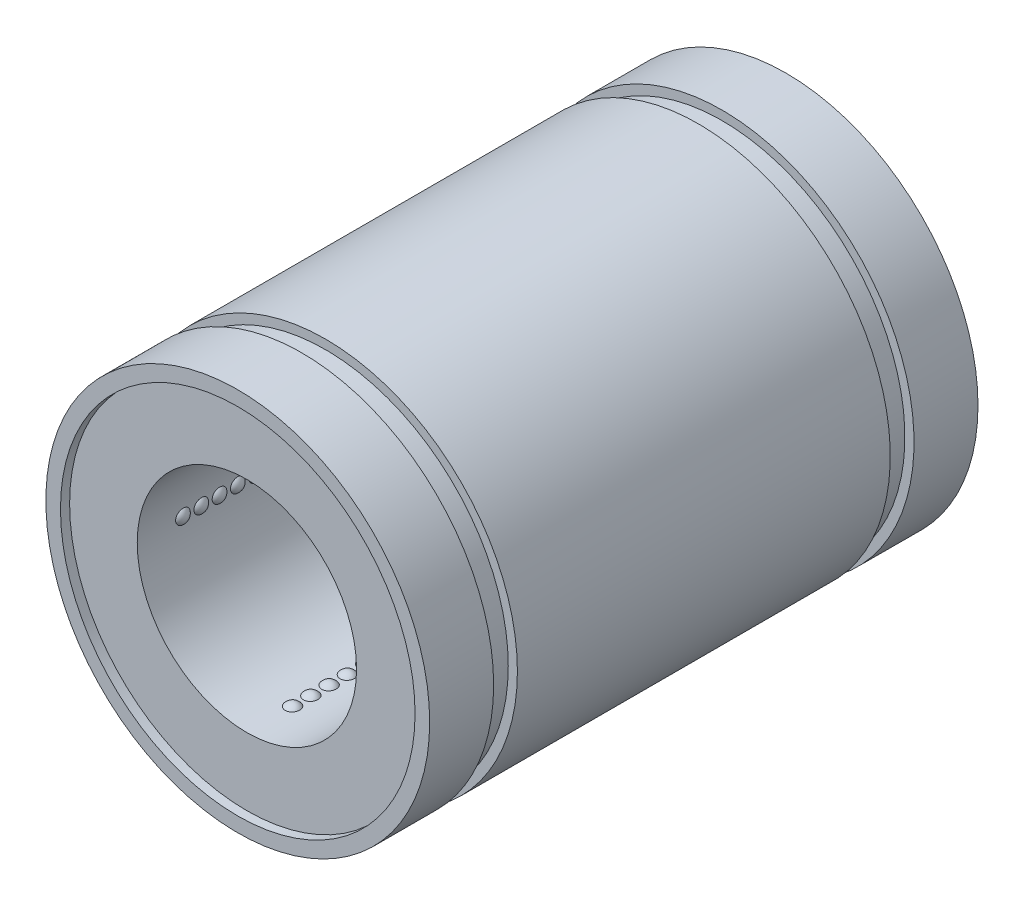
from build123d import *

# Parameters (mm, degrees)
SKETCH1_R           = 10.5
SKETCH1_R_2         = 6
BOSS_EXTRUDE1_DEPTH = 30
CUT_EXTRUDE1_START  = -0.5
SKETCH2_R           = 9.7
SKETCH2_R_2         = 6
CUT_EXTRUDE1_DEPTH  = 0.5
SKETCH3_R           = 9.7
SKETCH3_R_2         = 6
CUT_EXTRUDE2_DEPTH  = 0.5
LPATTERN1_COUNT     = 25
LPATTERN1_PITCH     = 1
CIRPATTERN1_COUNT   = 4
SKETCH5_R           = 11.625558181
SKETCH5_R_2         = 10
CUT_EXTRUDE3_DEPTH  = 1.3
CUT_EXTRUDE4_START  = -1.3
SKETCH6_R           = 11.731970737
SKETCH6_R_2         = 10
CUT_EXTRUDE4_DEPTH  = 1.3


with BuildPart() as part:
    # Sketch1 → Boss-Extrude1 (new body)
    with BuildSketch(Plane.XY):
        Circle(SKETCH1_R)
        Circle(SKETCH1_R_2, mode=Mode.SUBTRACT)
    extrude(amount=BOSS_EXTRUDE1_DEPTH)

    # Sketch2 → Cut-Extrude1 (cut)
    with BuildSketch(Plane.XY.offset(30).offset(CUT_EXTRUDE1_START)):
        Circle(SKETCH2_R)
        Circle(SKETCH2_R_2, mode=Mode.SUBTRACT)
    extrude(amount=CUT_EXTRUDE1_DEPTH, mode=Mode.SUBTRACT)

    # Sketch3 → Cut-Extrude2 (cut)
    with BuildSketch(Plane(origin=(0, 0, 0), x_dir=(-1, 0, 0), z_dir=(0, 0, -1))):
        with Locations(Location((0, 0, 0), (0, 0, 180))):
            Circle(SKETCH3_R)
        Circle(SKETCH3_R_2, mode=Mode.SUBTRACT)
    extrude(amount=-CUT_EXTRUDE2_DEPTH, mode=Mode.SUBTRACT)

    # Sketch4 → Revolve1 (revolve)
    with BuildSketch(Plane.XY.offset(27)):
        with BuildLine():
            Line((0, -5.8), (0, -6.8))
            ThreePointArc((0, -6.8), (0.5, -6.3), (0, -5.8))
        make_face()
    revolve1 = revolve(axis=Axis((0, -5.8, 27), (0, -1, 0)))

    # LPattern1: Revolve1 ×25
    with Locations(*[(0, 0, -i * LPATTERN1_PITCH) for i in range(1, LPATTERN1_COUNT)]):
        add(revolve1)

    # CirPattern1: Revolve1 ×4 about axis
    cirpattern1_axis = Axis((0, 0, 0), (0, 0, 1))
    for i in range(1, CIRPATTERN1_COUNT):
        add(revolve1.rotate(cirpattern1_axis, i * 360 / CIRPATTERN1_COUNT))

    # CirPattern1 copy 1 sketch → CirPattern1 copy 1 (revolve)
    with BuildSketch(Plane(origin=(0, 0, 26), x_dir=(0, 1, 0), z_dir=(0, 0, 1))):
        with BuildLine():
            Line((0, -5.8), (0, -6.8))
            ThreePointArc((0, -6.8), (0.5, -6.3), (0, -5.8))
        make_face()
    revolve(axis=Axis((5.8, 0, 26), (1, 0, 0)))

    # CirPattern1 copy 2 sketch → CirPattern1 copy 2 (revolve)
    with BuildSketch(Plane(origin=(0, 0, 26), x_dir=(-1, 0, 0), z_dir=(0, 0, 1))):
        with BuildLine():
            Line((0, -5.8), (0, -6.8))
            ThreePointArc((0, -6.8), (0.5, -6.3), (0, -5.8))
        make_face()
    revolve(axis=Axis((0, 5.8, 26), (0, 1, 0)))

    # CirPattern1 copy 3 sketch → CirPattern1 copy 3 (revolve)
    with BuildSketch(Plane(origin=(0, 0, 26), x_dir=(0, -1, 0), z_dir=(0, 0, 1))):
        with BuildLine():
            Line((0, -5.8), (0, -6.8))
            ThreePointArc((0, -6.8), (0.5, -6.3), (0, -5.8))
        make_face()
    revolve(axis=Axis((-5.8, 0, 26), (-1, 0, 0)))

    # CirPattern1 copy 4 sketch → CirPattern1 copy 4 (revolve)
    with BuildSketch(Plane(origin=(0, 0, 25), x_dir=(0, 1, 0), z_dir=(0, 0, 1))):
        with BuildLine():
            Line((0, -5.8), (0, -6.8))
            ThreePointArc((0, -6.8), (0.5, -6.3), (0, -5.8))
        make_face()
    revolve(axis=Axis((5.8, 0, 25), (1, 0, 0)))

    # CirPattern1 copy 5 sketch → CirPattern1 copy 5 (revolve)
    with BuildSketch(Plane(origin=(0, 0, 25), x_dir=(-1, 0, 0), z_dir=(0, 0, 1))):
        with BuildLine():
            Line((0, -5.8), (0, -6.8))
            ThreePointArc((0, -6.8), (0.5, -6.3), (0, -5.8))
        make_face()
    revolve(axis=Axis((0, 5.8, 25), (0, 1, 0)))

    # CirPattern1 copy 6 sketch → CirPattern1 copy 6 (revolve)
    with BuildSketch(Plane(origin=(0, 0, 25), x_dir=(0, -1, 0), z_dir=(0, 0, 1))):
        with BuildLine():
            Line((0, -5.8), (0, -6.8))
            ThreePointArc((0, -6.8), (0.5, -6.3), (0, -5.8))
        make_face()
    revolve(axis=Axis((-5.8, 0, 25), (-1, 0, 0)))

    # CirPattern1 copy 7 sketch → CirPattern1 copy 7 (revolve)
    with BuildSketch(Plane(origin=(0, 0, 24), x_dir=(0, 1, 0), z_dir=(0, 0, 1))):
        with BuildLine():
            Line((0, -5.8), (0, -6.8))
            ThreePointArc((0, -6.8), (0.5, -6.3), (0, -5.8))
        make_face()
    revolve(axis=Axis((5.8, 0, 24), (1, 0, 0)))

    # CirPattern1 copy 8 sketch → CirPattern1 copy 8 (revolve)
    with BuildSketch(Plane(origin=(0, 0, 24), x_dir=(-1, 0, 0), z_dir=(0, 0, 1))):
        with BuildLine():
            Line((0, -5.8), (0, -6.8))
            ThreePointArc((0, -6.8), (0.5, -6.3), (0, -5.8))
        make_face()
    revolve(axis=Axis((0, 5.8, 24), (0, 1, 0)))

    # CirPattern1 copy 9 sketch → CirPattern1 copy 9 (revolve)
    with BuildSketch(Plane(origin=(0, 0, 24), x_dir=(0, -1, 0), z_dir=(0, 0, 1))):
        with BuildLine():
            Line((0, -5.8), (0, -6.8))
            ThreePointArc((0, -6.8), (0.5, -6.3), (0, -5.8))
        make_face()
    revolve(axis=Axis((-5.8, 0, 24), (-1, 0, 0)))

    # CirPattern1 copy 10 sketch → CirPattern1 copy 10 (revolve)
    with BuildSketch(Plane(origin=(0, 0, 23), x_dir=(0, 1, 0), z_dir=(0, 0, 1))):
        with BuildLine():
            Line((0, -5.8), (0, -6.8))
            ThreePointArc((0, -6.8), (0.5, -6.3), (0, -5.8))
        make_face()
    revolve(axis=Axis((5.8, 0, 23), (1, 0, 0)))

    # CirPattern1 copy 11 sketch → CirPattern1 copy 11 (revolve)
    with BuildSketch(Plane(origin=(0, 0, 23), x_dir=(-1, 0, 0), z_dir=(0, 0, 1))):
        with BuildLine():
            Line((0, -5.8), (0, -6.8))
            ThreePointArc((0, -6.8), (0.5, -6.3), (0, -5.8))
        make_face()
    revolve(axis=Axis((0, 5.8, 23), (0, 1, 0)))

    # CirPattern1 copy 12 sketch → CirPattern1 copy 12 (revolve)
    with BuildSketch(Plane(origin=(0, 0, 23), x_dir=(0, -1, 0), z_dir=(0, 0, 1))):
        with BuildLine():
            Line((0, -5.8), (0, -6.8))
            ThreePointArc((0, -6.8), (0.5, -6.3), (0, -5.8))
        make_face()
    revolve(axis=Axis((-5.8, 0, 23), (-1, 0, 0)))

    # CirPattern1 copy 13 sketch → CirPattern1 copy 13 (revolve)
    with BuildSketch(Plane(origin=(0, 0, 22), x_dir=(0, 1, 0), z_dir=(0, 0, 1))):
        with BuildLine():
            Line((0, -5.8), (0, -6.8))
            ThreePointArc((0, -6.8), (0.5, -6.3), (0, -5.8))
        make_face()
    revolve(axis=Axis((5.8, 0, 22), (1, 0, 0)))

    # CirPattern1 copy 14 sketch → CirPattern1 copy 14 (revolve)
    with BuildSketch(Plane(origin=(0, 0, 22), x_dir=(-1, 0, 0), z_dir=(0, 0, 1))):
        with BuildLine():
            Line((0, -5.8), (0, -6.8))
            ThreePointArc((0, -6.8), (0.5, -6.3), (0, -5.8))
        make_face()
    revolve(axis=Axis((0, 5.8, 22), (0, 1, 0)))

    # CirPattern1 copy 15 sketch → CirPattern1 copy 15 (revolve)
    with BuildSketch(Plane(origin=(0, 0, 22), x_dir=(0, -1, 0), z_dir=(0, 0, 1))):
        with BuildLine():
            Line((0, -5.8), (0, -6.8))
            ThreePointArc((0, -6.8), (0.5, -6.3), (0, -5.8))
        make_face()
    revolve(axis=Axis((-5.8, 0, 22), (-1, 0, 0)))

    # CirPattern1 copy 16 sketch → CirPattern1 copy 16 (revolve)
    with BuildSketch(Plane(origin=(0, 0, 21), x_dir=(0, 1, 0), z_dir=(0, 0, 1))):
        with BuildLine():
            Line((0, -5.8), (0, -6.8))
            ThreePointArc((0, -6.8), (0.5, -6.3), (0, -5.8))
        make_face()
    revolve(axis=Axis((5.8, 0, 21), (1, 0, 0)))

    # CirPattern1 copy 17 sketch → CirPattern1 copy 17 (revolve)
    with BuildSketch(Plane(origin=(0, 0, 21), x_dir=(-1, 0, 0), z_dir=(0, 0, 1))):
        with BuildLine():
            Line((0, -5.8), (0, -6.8))
            ThreePointArc((0, -6.8), (0.5, -6.3), (0, -5.8))
        make_face()
    revolve(axis=Axis((0, 5.8, 21), (0, 1, 0)))

    # CirPattern1 copy 18 sketch → CirPattern1 copy 18 (revolve)
    with BuildSketch(Plane(origin=(0, 0, 21), x_dir=(0, -1, 0), z_dir=(0, 0, 1))):
        with BuildLine():
            Line((0, -5.8), (0, -6.8))
            ThreePointArc((0, -6.8), (0.5, -6.3), (0, -5.8))
        make_face()
    revolve(axis=Axis((-5.8, 0, 21), (-1, 0, 0)))

    # CirPattern1 copy 19 sketch → CirPattern1 copy 19 (revolve)
    with BuildSketch(Plane(origin=(0, 0, 20), x_dir=(0, 1, 0), z_dir=(0, 0, 1))):
        with BuildLine():
            Line((0, -5.8), (0, -6.8))
            ThreePointArc((0, -6.8), (0.5, -6.3), (0, -5.8))
        make_face()
    revolve(axis=Axis((5.8, 0, 20), (1, 0, 0)))

    # CirPattern1 copy 20 sketch → CirPattern1 copy 20 (revolve)
    with BuildSketch(Plane(origin=(0, 0, 20), x_dir=(-1, 0, 0), z_dir=(0, 0, 1))):
        with BuildLine():
            Line((0, -5.8), (0, -6.8))
            ThreePointArc((0, -6.8), (0.5, -6.3), (0, -5.8))
        make_face()
    revolve(axis=Axis((0, 5.8, 20), (0, 1, 0)))

    # CirPattern1 copy 21 sketch → CirPattern1 copy 21 (revolve)
    with BuildSketch(Plane(origin=(0, 0, 20), x_dir=(0, -1, 0), z_dir=(0, 0, 1))):
        with BuildLine():
            Line((0, -5.8), (0, -6.8))
            ThreePointArc((0, -6.8), (0.5, -6.3), (0, -5.8))
        make_face()
    revolve(axis=Axis((-5.8, 0, 20), (-1, 0, 0)))

    # CirPattern1 copy 22 sketch → CirPattern1 copy 22 (revolve)
    with BuildSketch(Plane(origin=(0, 0, 19), x_dir=(0, 1, 0), z_dir=(0, 0, 1))):
        with BuildLine():
            Line((0, -5.8), (0, -6.8))
            ThreePointArc((0, -6.8), (0.5, -6.3), (0, -5.8))
        make_face()
    revolve(axis=Axis((5.8, 0, 19), (1, 0, 0)))

    # CirPattern1 copy 23 sketch → CirPattern1 copy 23 (revolve)
    with BuildSketch(Plane(origin=(0, 0, 19), x_dir=(-1, 0, 0), z_dir=(0, 0, 1))):
        with BuildLine():
            Line((0, -5.8), (0, -6.8))
            ThreePointArc((0, -6.8), (0.5, -6.3), (0, -5.8))
        make_face()
    revolve(axis=Axis((0, 5.8, 19), (0, 1, 0)))

    # CirPattern1 copy 24 sketch → CirPattern1 copy 24 (revolve)
    with BuildSketch(Plane(origin=(0, 0, 19), x_dir=(0, -1, 0), z_dir=(0, 0, 1))):
        with BuildLine():
            Line((0, -5.8), (0, -6.8))
            ThreePointArc((0, -6.8), (0.5, -6.3), (0, -5.8))
        make_face()
    revolve(axis=Axis((-5.8, 0, 19), (-1, 0, 0)))

    # CirPattern1 copy 25 sketch → CirPattern1 copy 25 (revolve)
    with BuildSketch(Plane(origin=(0, 0, 18), x_dir=(0, 1, 0), z_dir=(0, 0, 1))):
        with BuildLine():
            Line((0, -5.8), (0, -6.8))
            ThreePointArc((0, -6.8), (0.5, -6.3), (0, -5.8))
        make_face()
    revolve(axis=Axis((5.8, 0, 18), (1, 0, 0)))

    # CirPattern1 copy 26 sketch → CirPattern1 copy 26 (revolve)
    with BuildSketch(Plane(origin=(0, 0, 18), x_dir=(-1, 0, 0), z_dir=(0, 0, 1))):
        with BuildLine():
            Line((0, -5.8), (0, -6.8))
            ThreePointArc((0, -6.8), (0.5, -6.3), (0, -5.8))
        make_face()
    revolve(axis=Axis((0, 5.8, 18), (0, 1, 0)))

    # CirPattern1 copy 27 sketch → CirPattern1 copy 27 (revolve)
    with BuildSketch(Plane(origin=(0, 0, 18), x_dir=(0, -1, 0), z_dir=(0, 0, 1))):
        with BuildLine():
            Line((0, -5.8), (0, -6.8))
            ThreePointArc((0, -6.8), (0.5, -6.3), (0, -5.8))
        make_face()
    revolve(axis=Axis((-5.8, 0, 18), (-1, 0, 0)))

    # CirPattern1 copy 28 sketch → CirPattern1 copy 28 (revolve)
    with BuildSketch(Plane(origin=(0, 0, 17), x_dir=(0, 1, 0), z_dir=(0, 0, 1))):
        with BuildLine():
            Line((0, -5.8), (0, -6.8))
            ThreePointArc((0, -6.8), (0.5, -6.3), (0, -5.8))
        make_face()
    revolve(axis=Axis((5.8, 0, 17), (1, 0, 0)))

    # CirPattern1 copy 29 sketch → CirPattern1 copy 29 (revolve)
    with BuildSketch(Plane(origin=(0, 0, 17), x_dir=(-1, 0, 0), z_dir=(0, 0, 1))):
        with BuildLine():
            Line((0, -5.8), (0, -6.8))
            ThreePointArc((0, -6.8), (0.5, -6.3), (0, -5.8))
        make_face()
    revolve(axis=Axis((0, 5.8, 17), (0, 1, 0)))

    # CirPattern1 copy 30 sketch → CirPattern1 copy 30 (revolve)
    with BuildSketch(Plane(origin=(0, 0, 17), x_dir=(0, -1, 0), z_dir=(0, 0, 1))):
        with BuildLine():
            Line((0, -5.8), (0, -6.8))
            ThreePointArc((0, -6.8), (0.5, -6.3), (0, -5.8))
        make_face()
    revolve(axis=Axis((-5.8, 0, 17), (-1, 0, 0)))

    # CirPattern1 copy 31 sketch → CirPattern1 copy 31 (revolve)
    with BuildSketch(Plane(origin=(0, 0, 16), x_dir=(0, 1, 0), z_dir=(0, 0, 1))):
        with BuildLine():
            Line((0, -5.8), (0, -6.8))
            ThreePointArc((0, -6.8), (0.5, -6.3), (0, -5.8))
        make_face()
    revolve(axis=Axis((5.8, 0, 16), (1, 0, 0)))

    # CirPattern1 copy 32 sketch → CirPattern1 copy 32 (revolve)
    with BuildSketch(Plane(origin=(0, 0, 16), x_dir=(-1, 0, 0), z_dir=(0, 0, 1))):
        with BuildLine():
            Line((0, -5.8), (0, -6.8))
            ThreePointArc((0, -6.8), (0.5, -6.3), (0, -5.8))
        make_face()
    revolve(axis=Axis((0, 5.8, 16), (0, 1, 0)))

    # CirPattern1 copy 33 sketch → CirPattern1 copy 33 (revolve)
    with BuildSketch(Plane(origin=(0, 0, 16), x_dir=(0, -1, 0), z_dir=(0, 0, 1))):
        with BuildLine():
            Line((0, -5.8), (0, -6.8))
            ThreePointArc((0, -6.8), (0.5, -6.3), (0, -5.8))
        make_face()
    revolve(axis=Axis((-5.8, 0, 16), (-1, 0, 0)))

    # CirPattern1 copy 34 sketch → CirPattern1 copy 34 (revolve)
    with BuildSketch(Plane(origin=(0, 0, 15), x_dir=(0, 1, 0), z_dir=(0, 0, 1))):
        with BuildLine():
            Line((0, -5.8), (0, -6.8))
            ThreePointArc((0, -6.8), (0.5, -6.3), (0, -5.8))
        make_face()
    revolve(axis=Axis((5.8, 0, 15), (1, 0, 0)))

    # CirPattern1 copy 35 sketch → CirPattern1 copy 35 (revolve)
    with BuildSketch(Plane(origin=(0, 0, 15), x_dir=(-1, 0, 0), z_dir=(0, 0, 1))):
        with BuildLine():
            Line((0, -5.8), (0, -6.8))
            ThreePointArc((0, -6.8), (0.5, -6.3), (0, -5.8))
        make_face()
    revolve(axis=Axis((0, 5.8, 15), (0, 1, 0)))

    # CirPattern1 copy 36 sketch → CirPattern1 copy 36 (revolve)
    with BuildSketch(Plane(origin=(0, 0, 15), x_dir=(0, -1, 0), z_dir=(0, 0, 1))):
        with BuildLine():
            Line((0, -5.8), (0, -6.8))
            ThreePointArc((0, -6.8), (0.5, -6.3), (0, -5.8))
        make_face()
    revolve(axis=Axis((-5.8, 0, 15), (-1, 0, 0)))

    # CirPattern1 copy 37 sketch → CirPattern1 copy 37 (revolve)
    with BuildSketch(Plane(origin=(0, 0, 14), x_dir=(0, 1, 0), z_dir=(0, 0, 1))):
        with BuildLine():
            Line((0, -5.8), (0, -6.8))
            ThreePointArc((0, -6.8), (0.5, -6.3), (0, -5.8))
        make_face()
    revolve(axis=Axis((5.8, 0, 14), (1, 0, 0)))

    # CirPattern1 copy 38 sketch → CirPattern1 copy 38 (revolve)
    with BuildSketch(Plane(origin=(0, 0, 14), x_dir=(-1, 0, 0), z_dir=(0, 0, 1))):
        with BuildLine():
            Line((0, -5.8), (0, -6.8))
            ThreePointArc((0, -6.8), (0.5, -6.3), (0, -5.8))
        make_face()
    revolve(axis=Axis((0, 5.8, 14), (0, 1, 0)))

    # CirPattern1 copy 39 sketch → CirPattern1 copy 39 (revolve)
    with BuildSketch(Plane(origin=(0, 0, 14), x_dir=(0, -1, 0), z_dir=(0, 0, 1))):
        with BuildLine():
            Line((0, -5.8), (0, -6.8))
            ThreePointArc((0, -6.8), (0.5, -6.3), (0, -5.8))
        make_face()
    revolve(axis=Axis((-5.8, 0, 14), (-1, 0, 0)))

    # CirPattern1 copy 40 sketch → CirPattern1 copy 40 (revolve)
    with BuildSketch(Plane(origin=(0, 0, 13), x_dir=(0, 1, 0), z_dir=(0, 0, 1))):
        with BuildLine():
            Line((0, -5.8), (0, -6.8))
            ThreePointArc((0, -6.8), (0.5, -6.3), (0, -5.8))
        make_face()
    revolve(axis=Axis((5.8, 0, 13), (1, 0, 0)))

    # CirPattern1 copy 41 sketch → CirPattern1 copy 41 (revolve)
    with BuildSketch(Plane(origin=(0, 0, 13), x_dir=(-1, 0, 0), z_dir=(0, 0, 1))):
        with BuildLine():
            Line((0, -5.8), (0, -6.8))
            ThreePointArc((0, -6.8), (0.5, -6.3), (0, -5.8))
        make_face()
    revolve(axis=Axis((0, 5.8, 13), (0, 1, 0)))

    # CirPattern1 copy 42 sketch → CirPattern1 copy 42 (revolve)
    with BuildSketch(Plane(origin=(0, 0, 13), x_dir=(0, -1, 0), z_dir=(0, 0, 1))):
        with BuildLine():
            Line((0, -5.8), (0, -6.8))
            ThreePointArc((0, -6.8), (0.5, -6.3), (0, -5.8))
        make_face()
    revolve(axis=Axis((-5.8, 0, 13), (-1, 0, 0)))

    # CirPattern1 copy 43 sketch → CirPattern1 copy 43 (revolve)
    with BuildSketch(Plane(origin=(0, 0, 12), x_dir=(0, 1, 0), z_dir=(0, 0, 1))):
        with BuildLine():
            Line((0, -5.8), (0, -6.8))
            ThreePointArc((0, -6.8), (0.5, -6.3), (0, -5.8))
        make_face()
    revolve(axis=Axis((5.8, 0, 12), (1, 0, 0)))

    # CirPattern1 copy 44 sketch → CirPattern1 copy 44 (revolve)
    with BuildSketch(Plane(origin=(0, 0, 12), x_dir=(-1, 0, 0), z_dir=(0, 0, 1))):
        with BuildLine():
            Line((0, -5.8), (0, -6.8))
            ThreePointArc((0, -6.8), (0.5, -6.3), (0, -5.8))
        make_face()
    revolve(axis=Axis((0, 5.8, 12), (0, 1, 0)))

    # CirPattern1 copy 45 sketch → CirPattern1 copy 45 (revolve)
    with BuildSketch(Plane(origin=(0, 0, 12), x_dir=(0, -1, 0), z_dir=(0, 0, 1))):
        with BuildLine():
            Line((0, -5.8), (0, -6.8))
            ThreePointArc((0, -6.8), (0.5, -6.3), (0, -5.8))
        make_face()
    revolve(axis=Axis((-5.8, 0, 12), (-1, 0, 0)))

    # CirPattern1 copy 46 sketch → CirPattern1 copy 46 (revolve)
    with BuildSketch(Plane(origin=(0, 0, 11), x_dir=(0, 1, 0), z_dir=(0, 0, 1))):
        with BuildLine():
            Line((0, -5.8), (0, -6.8))
            ThreePointArc((0, -6.8), (0.5, -6.3), (0, -5.8))
        make_face()
    revolve(axis=Axis((5.8, 0, 11), (1, 0, 0)))

    # CirPattern1 copy 47 sketch → CirPattern1 copy 47 (revolve)
    with BuildSketch(Plane(origin=(0, 0, 11), x_dir=(-1, 0, 0), z_dir=(0, 0, 1))):
        with BuildLine():
            Line((0, -5.8), (0, -6.8))
            ThreePointArc((0, -6.8), (0.5, -6.3), (0, -5.8))
        make_face()
    revolve(axis=Axis((0, 5.8, 11), (0, 1, 0)))

    # CirPattern1 copy 48 sketch → CirPattern1 copy 48 (revolve)
    with BuildSketch(Plane(origin=(0, 0, 11), x_dir=(0, -1, 0), z_dir=(0, 0, 1))):
        with BuildLine():
            Line((0, -5.8), (0, -6.8))
            ThreePointArc((0, -6.8), (0.5, -6.3), (0, -5.8))
        make_face()
    revolve(axis=Axis((-5.8, 0, 11), (-1, 0, 0)))

    # CirPattern1 copy 49 sketch → CirPattern1 copy 49 (revolve)
    with BuildSketch(Plane(origin=(0, 0, 10), x_dir=(0, 1, 0), z_dir=(0, 0, 1))):
        with BuildLine():
            Line((0, -5.8), (0, -6.8))
            ThreePointArc((0, -6.8), (0.5, -6.3), (0, -5.8))
        make_face()
    revolve(axis=Axis((5.8, 0, 10), (1, 0, 0)))

    # CirPattern1 copy 50 sketch → CirPattern1 copy 50 (revolve)
    with BuildSketch(Plane(origin=(0, 0, 10), x_dir=(-1, 0, 0), z_dir=(0, 0, 1))):
        with BuildLine():
            Line((0, -5.8), (0, -6.8))
            ThreePointArc((0, -6.8), (0.5, -6.3), (0, -5.8))
        make_face()
    revolve(axis=Axis((0, 5.8, 10), (0, 1, 0)))

    # CirPattern1 copy 51 sketch → CirPattern1 copy 51 (revolve)
    with BuildSketch(Plane(origin=(0, 0, 10), x_dir=(0, -1, 0), z_dir=(0, 0, 1))):
        with BuildLine():
            Line((0, -5.8), (0, -6.8))
            ThreePointArc((0, -6.8), (0.5, -6.3), (0, -5.8))
        make_face()
    revolve(axis=Axis((-5.8, 0, 10), (-1, 0, 0)))

    # CirPattern1 copy 52 sketch → CirPattern1 copy 52 (revolve)
    with BuildSketch(Plane(origin=(0, 0, 9), x_dir=(0, 1, 0), z_dir=(0, 0, 1))):
        with BuildLine():
            Line((0, -5.8), (0, -6.8))
            ThreePointArc((0, -6.8), (0.5, -6.3), (0, -5.8))
        make_face()
    revolve(axis=Axis((5.8, 0, 9), (1, 0, 0)))

    # CirPattern1 copy 53 sketch → CirPattern1 copy 53 (revolve)
    with BuildSketch(Plane(origin=(0, 0, 9), x_dir=(-1, 0, 0), z_dir=(0, 0, 1))):
        with BuildLine():
            Line((0, -5.8), (0, -6.8))
            ThreePointArc((0, -6.8), (0.5, -6.3), (0, -5.8))
        make_face()
    revolve(axis=Axis((0, 5.8, 9), (0, 1, 0)))

    # CirPattern1 copy 54 sketch → CirPattern1 copy 54 (revolve)
    with BuildSketch(Plane(origin=(0, 0, 9), x_dir=(0, -1, 0), z_dir=(0, 0, 1))):
        with BuildLine():
            Line((0, -5.8), (0, -6.8))
            ThreePointArc((0, -6.8), (0.5, -6.3), (0, -5.8))
        make_face()
    revolve(axis=Axis((-5.8, 0, 9), (-1, 0, 0)))

    # CirPattern1 copy 55 sketch → CirPattern1 copy 55 (revolve)
    with BuildSketch(Plane(origin=(0, 0, 8), x_dir=(0, 1, 0), z_dir=(0, 0, 1))):
        with BuildLine():
            Line((0, -5.8), (0, -6.8))
            ThreePointArc((0, -6.8), (0.5, -6.3), (0, -5.8))
        make_face()
    revolve(axis=Axis((5.8, 0, 8), (1, 0, 0)))

    # CirPattern1 copy 56 sketch → CirPattern1 copy 56 (revolve)
    with BuildSketch(Plane(origin=(0, 0, 8), x_dir=(-1, 0, 0), z_dir=(0, 0, 1))):
        with BuildLine():
            Line((0, -5.8), (0, -6.8))
            ThreePointArc((0, -6.8), (0.5, -6.3), (0, -5.8))
        make_face()
    revolve(axis=Axis((0, 5.8, 8), (0, 1, 0)))

    # CirPattern1 copy 57 sketch → CirPattern1 copy 57 (revolve)
    with BuildSketch(Plane(origin=(0, 0, 8), x_dir=(0, -1, 0), z_dir=(0, 0, 1))):
        with BuildLine():
            Line((0, -5.8), (0, -6.8))
            ThreePointArc((0, -6.8), (0.5, -6.3), (0, -5.8))
        make_face()
    revolve(axis=Axis((-5.8, 0, 8), (-1, 0, 0)))

    # CirPattern1 copy 58 sketch → CirPattern1 copy 58 (revolve)
    with BuildSketch(Plane(origin=(0, 0, 7), x_dir=(0, 1, 0), z_dir=(0, 0, 1))):
        with BuildLine():
            Line((0, -5.8), (0, -6.8))
            ThreePointArc((0, -6.8), (0.5, -6.3), (0, -5.8))
        make_face()
    revolve(axis=Axis((5.8, 0, 7), (1, 0, 0)))

    # CirPattern1 copy 59 sketch → CirPattern1 copy 59 (revolve)
    with BuildSketch(Plane(origin=(0, 0, 7), x_dir=(-1, 0, 0), z_dir=(0, 0, 1))):
        with BuildLine():
            Line((0, -5.8), (0, -6.8))
            ThreePointArc((0, -6.8), (0.5, -6.3), (0, -5.8))
        make_face()
    revolve(axis=Axis((0, 5.8, 7), (0, 1, 0)))

    # CirPattern1 copy 60 sketch → CirPattern1 copy 60 (revolve)
    with BuildSketch(Plane(origin=(0, 0, 7), x_dir=(0, -1, 0), z_dir=(0, 0, 1))):
        with BuildLine():
            Line((0, -5.8), (0, -6.8))
            ThreePointArc((0, -6.8), (0.5, -6.3), (0, -5.8))
        make_face()
    revolve(axis=Axis((-5.8, 0, 7), (-1, 0, 0)))

    # CirPattern1 copy 61 sketch → CirPattern1 copy 61 (revolve)
    with BuildSketch(Plane(origin=(0, 0, 6), x_dir=(0, 1, 0), z_dir=(0, 0, 1))):
        with BuildLine():
            Line((0, -5.8), (0, -6.8))
            ThreePointArc((0, -6.8), (0.5, -6.3), (0, -5.8))
        make_face()
    revolve(axis=Axis((5.8, 0, 6), (1, 0, 0)))

    # CirPattern1 copy 62 sketch → CirPattern1 copy 62 (revolve)
    with BuildSketch(Plane(origin=(0, 0, 6), x_dir=(-1, 0, 0), z_dir=(0, 0, 1))):
        with BuildLine():
            Line((0, -5.8), (0, -6.8))
            ThreePointArc((0, -6.8), (0.5, -6.3), (0, -5.8))
        make_face()
    revolve(axis=Axis((0, 5.8, 6), (0, 1, 0)))

    # CirPattern1 copy 63 sketch → CirPattern1 copy 63 (revolve)
    with BuildSketch(Plane(origin=(0, 0, 6), x_dir=(0, -1, 0), z_dir=(0, 0, 1))):
        with BuildLine():
            Line((0, -5.8), (0, -6.8))
            ThreePointArc((0, -6.8), (0.5, -6.3), (0, -5.8))
        make_face()
    revolve(axis=Axis((-5.8, 0, 6), (-1, 0, 0)))

    # CirPattern1 copy 64 sketch → CirPattern1 copy 64 (revolve)
    with BuildSketch(Plane(origin=(0, 0, 5), x_dir=(0, 1, 0), z_dir=(0, 0, 1))):
        with BuildLine():
            Line((0, -5.8), (0, -6.8))
            ThreePointArc((0, -6.8), (0.5, -6.3), (0, -5.8))
        make_face()
    revolve(axis=Axis((5.8, 0, 5), (1, 0, 0)))

    # CirPattern1 copy 65 sketch → CirPattern1 copy 65 (revolve)
    with BuildSketch(Plane(origin=(0, 0, 5), x_dir=(-1, 0, 0), z_dir=(0, 0, 1))):
        with BuildLine():
            Line((0, -5.8), (0, -6.8))
            ThreePointArc((0, -6.8), (0.5, -6.3), (0, -5.8))
        make_face()
    revolve(axis=Axis((0, 5.8, 5), (0, 1, 0)))

    # CirPattern1 copy 66 sketch → CirPattern1 copy 66 (revolve)
    with BuildSketch(Plane(origin=(0, 0, 5), x_dir=(0, -1, 0), z_dir=(0, 0, 1))):
        with BuildLine():
            Line((0, -5.8), (0, -6.8))
            ThreePointArc((0, -6.8), (0.5, -6.3), (0, -5.8))
        make_face()
    revolve(axis=Axis((-5.8, 0, 5), (-1, 0, 0)))

    # CirPattern1 copy 67 sketch → CirPattern1 copy 67 (revolve)
    with BuildSketch(Plane(origin=(0, 0, 4), x_dir=(0, 1, 0), z_dir=(0, 0, 1))):
        with BuildLine():
            Line((0, -5.8), (0, -6.8))
            ThreePointArc((0, -6.8), (0.5, -6.3), (0, -5.8))
        make_face()
    revolve(axis=Axis((5.8, 0, 4), (1, 0, 0)))

    # CirPattern1 copy 68 sketch → CirPattern1 copy 68 (revolve)
    with BuildSketch(Plane(origin=(0, 0, 4), x_dir=(-1, 0, 0), z_dir=(0, 0, 1))):
        with BuildLine():
            Line((0, -5.8), (0, -6.8))
            ThreePointArc((0, -6.8), (0.5, -6.3), (0, -5.8))
        make_face()
    revolve(axis=Axis((0, 5.8, 4), (0, 1, 0)))

    # CirPattern1 copy 69 sketch → CirPattern1 copy 69 (revolve)
    with BuildSketch(Plane(origin=(0, 0, 4), x_dir=(0, -1, 0), z_dir=(0, 0, 1))):
        with BuildLine():
            Line((0, -5.8), (0, -6.8))
            ThreePointArc((0, -6.8), (0.5, -6.3), (0, -5.8))
        make_face()
    revolve(axis=Axis((-5.8, 0, 4), (-1, 0, 0)))

    # CirPattern1 copy 70 sketch → CirPattern1 copy 70 (revolve)
    with BuildSketch(Plane(origin=(0, 0, 3), x_dir=(0, 1, 0), z_dir=(0, 0, 1))):
        with BuildLine():
            Line((0, -5.8), (0, -6.8))
            ThreePointArc((0, -6.8), (0.5, -6.3), (0, -5.8))
        make_face()
    revolve(axis=Axis((5.8, 0, 3), (1, 0, 0)))

    # CirPattern1 copy 71 sketch → CirPattern1 copy 71 (revolve)
    with BuildSketch(Plane(origin=(0, 0, 3), x_dir=(-1, 0, 0), z_dir=(0, 0, 1))):
        with BuildLine():
            Line((0, -5.8), (0, -6.8))
            ThreePointArc((0, -6.8), (0.5, -6.3), (0, -5.8))
        make_face()
    revolve(axis=Axis((0, 5.8, 3), (0, 1, 0)))

    # CirPattern1 copy 72 sketch → CirPattern1 copy 72 (revolve)
    with BuildSketch(Plane(origin=(0, 0, 3), x_dir=(0, -1, 0), z_dir=(0, 0, 1))):
        with BuildLine():
            Line((0, -5.8), (0, -6.8))
            ThreePointArc((0, -6.8), (0.5, -6.3), (0, -5.8))
        make_face()
    revolve(axis=Axis((-5.8, 0, 3), (-1, 0, 0)))

    # Sketch5 → Cut-Extrude3 (cut)
    with BuildSketch(Plane(origin=(0, 0, 3.5), x_dir=(-1, 0, 0), z_dir=(0, 0, -1))):
        Circle(SKETCH5_R)
        Circle(SKETCH5_R_2, mode=Mode.SUBTRACT)
    extrude(amount=-CUT_EXTRUDE3_DEPTH, mode=Mode.SUBTRACT)

    # Sketch6 → Cut-Extrude4 (cut)
    with BuildSketch(Plane.XY.offset(26.5).offset(CUT_EXTRUDE4_START)):
        Circle(SKETCH6_R)
        with Locations(Location((0, 0, 0), (0, 0, 180))):
            Circle(SKETCH6_R_2, mode=Mode.SUBTRACT)
    extrude(amount=CUT_EXTRUDE4_DEPTH, mode=Mode.SUBTRACT)


solid = part.part
